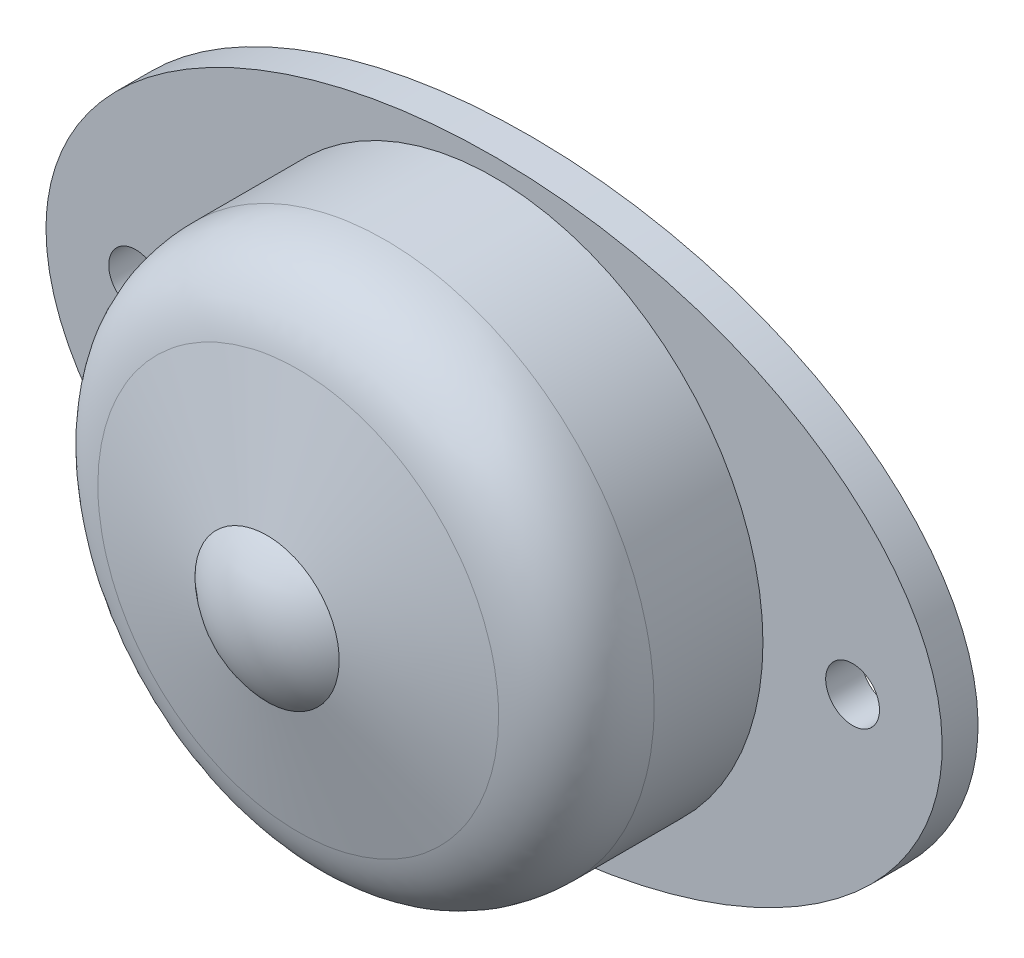
from build123d import *

# Parameters (mm, degrees)
SKETCH1_RX          = 25
SKETCH1_RY          = 16
SKETCH1_R           = 15
SKETCH1_R_2         = 1.5
BOSS_EXTRUDE6_DEPTH = 2
SKETCH1_11_R        = 15
SKETCH1_11_R_2      = 7.5
BOSS_EXTRUDE7_DEPTH = 12


with BuildPart() as part:
    # Sketch1 → Boss-Extrude6 (new body)
    with BuildSketch(Plane.XY):
        with Locations(Location((0, 0), (0, 0, 180))):
            Ellipse(SKETCH1_RX, SKETCH1_RY)
        Circle(SKETCH1_R, mode=Mode.SUBTRACT)
        with Locations((-20, 0)):
            Circle(SKETCH1_R_2, mode=Mode.SUBTRACT)
        with Locations((20, 0)):
            Circle(SKETCH1_R_2, mode=Mode.SUBTRACT)
    extrude(amount=BOSS_EXTRUDE6_DEPTH)

    # Sketch1<11> → Boss-Extrude7 (add)
    with BuildSketch(Plane.XY):
        Circle(SKETCH1_11_R)
        Circle(SKETCH1_11_R_2, mode=Mode.SUBTRACT)
    extrude(amount=BOSS_EXTRUDE7_DEPTH)

    # Sketch6 → Revolve2 (revolve)
    with BuildSketch(Plane(origin=(0, 0, 0), x_dir=(0, 0, -1), z_dir=(1, 0, 0)), mode=Mode.PRIVATE) as revolve2_sk:
        Polygon((-12, 15), (-14.666344011, 4.0237782), (-12, 7.5), align=None)
    revolve(revolve2_sk.sketch.rotate(Axis((0, 0, 0), (0, 0, 1)), 90), axis=Axis((0, 0, 0), (0, 0, 1)))

    # Fillet1
    # a fillet whose section is not a circle: 5 mm, written as the material it takes off along each edge
    with BuildSketch(Plane(origin=(0, 0, 12), x_dir=(-1, 0, 0), z_dir=(0, 1, 0))) as fillet1_piece_1:
        with BuildLine():
            Bezier((15, -3.93081081), (15, 0), (11.180275121, 0.927887641), weights=[1, 1, 1])
            Line((11.180275121, 0.927887641), (15, 0))
            Line((15, 0), (15, -3.93081081))
        make_face()
    revolve(axis=Axis((0, 0, 12), (0, 0, 1)), revolution_arc=180, mode=Mode.SUBTRACT)
    with BuildSketch(Plane(origin=(0, 0, 12), x_dir=(1, 0, 0), z_dir=(0, -1, 0))) as fillet1_piece_2:
        with BuildLine():
            Bezier((15, -3.93081081), (15, 0), (11.180275121, 0.927887641), weights=[1, 1, 1])
            Line((11.180275121, 0.927887641), (15, 0))
            Line((15, 0), (15, -3.93081081))
        make_face()
    revolve(axis=Axis((0, 0, 12), (0, 0, 1)), revolution_arc=180, mode=Mode.SUBTRACT)


with BuildPart() as body_2:
    # Sketch5 → Revolve1 (revolve)
    with BuildSketch(Plane(origin=(0, 0, 0), x_dir=(0, 0, -1), z_dir=(1, 0, 0))):
        with BuildLine():
            Line((-10.215590255, 6), (-10.215590255, -6))
            ThreePointArc((-10.215590255, -6), (-16.215590255, 0), (-10.215590255, 6))
        make_face()
    revolve(axis=Axis((0, 6, 10.215590255), (0, -1, 0)))


solid = Compound([part.part, body_2.part])
